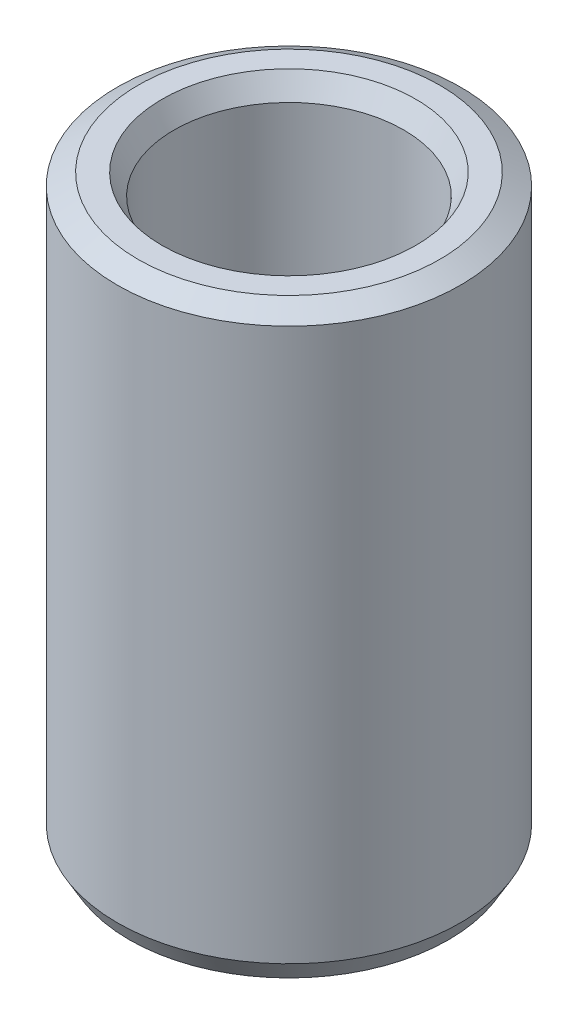
from build123d import *
from OCP.BRepFilletAPI import BRepFilletAPI_MakeChamfer

# Parameters (mm, degrees)
SKETCH1_R           = 37.5
BOSS_EXTRUDE1_DEPTH = 127.807900286
SKETCH2_R           = 25.09553703
CUT_EXTRUDE1_DEPTH  = 139.373983738
CHAMFER1_SIZE       = 2.61406047
CHAMFER1_SIZE2      = 4.527685548


with BuildPart() as part:
    # Sketch1 → Boss-Extrude1 (new body)
    with BuildSketch(Plane(origin=(0, 0, 0), x_dir=(1, 0, 0), z_dir=(0, 1, 0))):
        Circle(SKETCH1_R)
    extrude(amount=BOSS_EXTRUDE1_DEPTH)

    # Sketch2 → Cut-Extrude1 (cut, through all)
    with BuildSketch(Plane(origin=(0, 0, 0), x_dir=(1, 0, 0), z_dir=(0, 1, 0))):
        Circle(SKETCH2_R)
    extrude(amount=CUT_EXTRUDE1_DEPTH, mode=Mode.SUBTRACT)

    # Chamfer1: one chamfer whose edges measure the first distance from different faces: ONE call of the kernel's chamfer builder (chamfer() names one face for all edges)
    chamfer1_edges_1 = [part.edges().sort_by_distance(p)[0] for p in [
        (-25.09553703, 127.807900286, 0),
    ]]
    chamfer1_side_1 = [part.faces().sort_by_distance(p)[0] for p in [
        (-36.439339828, 127.807900286, 0),
    ]]
    chamfer1_edges_2 = [part.edges().sort_by_distance(p)[0] for p in [
        (-25.09553703, 0, 0),
    ]]
    chamfer1_side_2 = [part.faces().sort_by_distance(p)[0] for p in [
        (-25.09553703, 63.903950143, 0),
    ]]
    chamfer1_edges_3 = [part.edges().sort_by_distance(p)[0] for p in [
        (-37.5, 0, 0),
    ]]
    chamfer1_side_3 = [part.faces().sort_by_distance(p)[0] for p in [
        (-36.439339828, 0, 0),
    ]]
    chamfer1_edges_4 = [part.edges().sort_by_distance(p)[0] for p in [
        (-37.5, 127.807900286, 0),
    ]]
    chamfer1_side_4 = [part.faces().sort_by_distance(p)[0] for p in [
        (-37.5, 63.903950143, 0),
    ]]
    chamfer1 = BRepFilletAPI_MakeChamfer(part.part.solid().wrapped)
    for e in chamfer1_edges_1:
        chamfer1.Add(CHAMFER1_SIZE, CHAMFER1_SIZE2, e.wrapped, chamfer1_side_1[0].wrapped)  # the first distance lies on this face
    for e in chamfer1_edges_2:
        chamfer1.Add(CHAMFER1_SIZE, CHAMFER1_SIZE2, e.wrapped, chamfer1_side_2[0].wrapped)  # the first distance lies on this face
    for e in chamfer1_edges_3:
        chamfer1.Add(CHAMFER1_SIZE, CHAMFER1_SIZE2, e.wrapped, chamfer1_side_3[0].wrapped)  # the first distance lies on this face
    for e in chamfer1_edges_4:
        chamfer1.Add(CHAMFER1_SIZE, CHAMFER1_SIZE2, e.wrapped, chamfer1_side_4[0].wrapped)  # the first distance lies on this face
    add(Compound.cast(chamfer1.Shape()), mode=Mode.REPLACE)


solid = part.part
